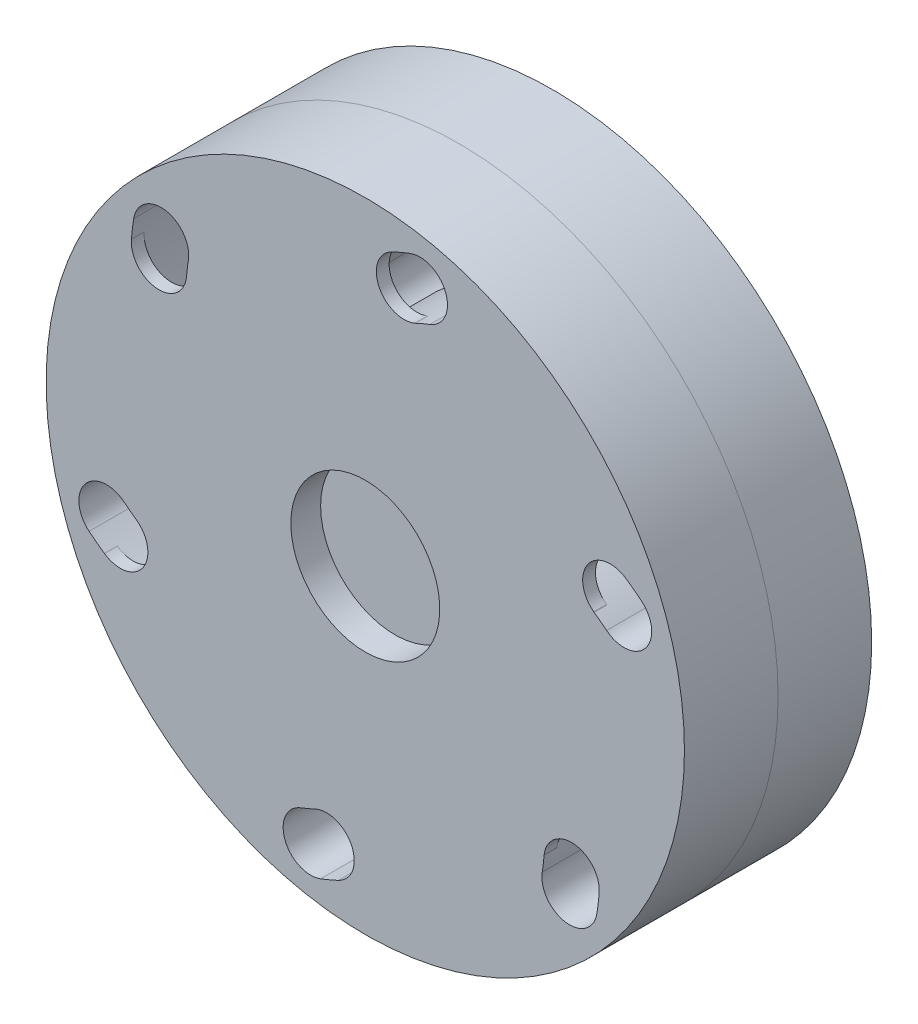
from build123d import *

# Parameters (mm, degrees)
SKETCH1_R                = 75
SKETCH1_R_2              = 70
BOSS_EXTRUDE1_DEPTH      = 22
CUT_EXTRUDE2_DEPTH       = 19
CUT_EXTRUDE3_DEPTH       = 10
CUT_EXTRUDE7_DEPTH       = 8
CUT_EXTRUDE6_START       = 109.323589305
CUT_EXTRUDE6_DEPTH       = 113.823589305
CUT_EXTRUDE8_DEPTH       = 9.25
SKETCH11_R               = 3
CUT_EXTRUDE9_DEPTH       = 9.25
CUT_EXTRUDE10_START      = -3
CUT_EXTRUDE10_DEPTH      = 3
CIRPATTERN2_COUNT        = 6
SKETCH18_R               = 5
CUT_EXTRUDE13_DEPTH      = 5
CUT_EXTRUDE14_DEPTH      = 115.830309588
CUT_EXTRUDE14_DEPTH_BACK = 7
SKETCH20_R               = 17.5


# Read off the part's stored shape, not the designer's step: Cut-Extrude10
with BuildPart() as part:
    # Sketch1 → Boss-Extrude1 (new body)
    # profile 1 of 2: a face of its own
    with BuildSketch(Plane.XY):
        Circle(SKETCH1_R)
        Circle(SKETCH1_R_2, mode=Mode.SUBTRACT)
    # profile 2 of 2: a face of its own
    with BuildSketch(Plane.XY):
        Circle(SKETCH1_R_2)
    extrude(amount=BOSS_EXTRUDE1_DEPTH)

    # Sketch4 → Cut-Extrude2 (cut)
    with BuildSketch(Plane.XY.offset(22)):
        with BuildLine():
            ThreePointArc((54.419786726, -43.518007072), (53.216834216, -18.476231144), (42.119786726, 4.004720201))
            ThreePointArc((42.119786726, 4.004720201), (32.995279799, 5.119786726), (31.880213274, -4.004720201))
            ThreePointArc((31.880213274, -4.004720201), (40.631543409, -21.733600529), (41.580213274, -41.481992928))
            ThreePointArc((41.580213274, -41.481992928), (46.981992928, -48.919786726), (54.419786726, -43.518007072))
        make_face()
    cut_extrude2 = extrude(amount=-CUT_EXTRUDE2_DEPTH, mode=Mode.SUBTRACT)

    # Sketch4<3> → Cut-Extrude3 (cut)
    with BuildSketch(Plane.XY.offset(22)):
        with BuildLine():
            ThreePointArc((39.995234493, -40.237763011), (33.113375849, -8.776911902), (7.518049478, 10.768532552))
            ThreePointArc((7.518049478, 10.768532552), (5.328436439, 9.615018469), (6.481950522, 7.42540543))
            ThreePointArc((6.481950522, 7.42540543), (30.16104925, -10.656743717), (36.52768853, -39.762236989))
            ThreePointArc((36.52768853, -39.762236989), (38.023698501, -41.733772981), (39.995234493, -40.237763011))
        make_face()
    cut_extrude3 = extrude(amount=-CUT_EXTRUDE3_DEPTH, mode=Mode.SUBTRACT)

    # Sketch7 → Cut-Extrude7 (cut)
    with BuildSketch(Plane.XY.offset(22)):
        with BuildLine():
            ThreePointArc((31.880213274, -4.004720201), (30.193449169, -1.965487549), (28.397965297, -0.021296041))
            ThreePointArc((28.397965297, -0.021296041), (28.5124774, 9.170378412), (37.704151864, 9.05586715))
            ThreePointArc((37.704151864, 9.05586715), (39.980899892, 6.590551742), (42.119786726, 4.004720201))
            ThreePointArc((42.119786726, 4.004720201), (32.995279799, 5.119786726), (31.880213274, -4.004720201))
        make_face()
    cut_extrude7 = extrude(amount=-CUT_EXTRUDE7_DEPTH, mode=Mode.SUBTRACT)

    # Sketch6 → Cut-Extrude6 (cut)
    with BuildSketch(Plane.XY.offset(22).offset(CUT_EXTRUDE6_START)):
        with BuildLine():
            ThreePointArc((41.580213274, -41.481992928), (42.740685569, -46.319635023), (46.981992928, -48.919786726))
            Line((46.981992928, -48.919786726), (37.945539013, -48.919786726))
            ThreePointArc((37.945539013, -48.919786726), (35.329112337, -12.653855306), (7.518049478, 10.768532552))
            Line((7.518049478, 10.768532552), (28.5124774, 9.170378412))
            ThreePointArc((28.5124774, 9.170378412), (26.551563362, 4.598257417), (28.397965297, -0.021296041))
            ThreePointArc((28.397965297, -0.021296041), (39.898780935, -19.190629411), (41.580213274, -41.481992928))
        make_face()
    cut_extrude6 = extrude(amount=-CUT_EXTRUDE6_DEPTH, mode=Mode.SUBTRACT)

    # Sketch9 → Cut-Extrude8 (cut)
    with BuildSketch(Plane.XY.offset(22)):
        with BuildLine():
            ThreePointArc((36.460255403, -40.234588948), (30.675277082, -11.484803097), (7.880639715, 6.965689252))
            ThreePointArc((7.880639715, 6.965689252), (6.607721905, 6.349507258), (7.223903899, 5.076589449))
            ThreePointArc((7.223903899, 5.076589449), (28.96445399, -12.520700943), (34.481918862, -39.941016928))
            ThreePointArc((34.481918862, -39.941016928), (35.324301122, -41.076971208), (36.460255403, -40.234588948))
        make_face()
    cut_extrude8 = extrude(amount=-CUT_EXTRUDE8_DEPTH, mode=Mode.SUBTRACT)

    # Sketch11 → Cut-Extrude9 (cut)
    with BuildSketch(Plane.XY.offset(22)):
        with BuildLine():
            Line((34.782544278, -30.416401894), (20.063474663, -45.986137745))
            ThreePointArc((20.063474663, -45.986137745), (23.0980049, -59.723306078), (34.740250052, -51.825439568))
            Line((34.740250052, -51.825439568), (36.460255403, -40.234588948))
            ThreePointArc((36.460255403, -40.234588948), (35.324301122, -41.076971208), (34.481918862, -39.941016928))
            ThreePointArc((34.481918862, -39.941016928), (34.908195949, -35.187419674), (34.782544278, -30.416401894))
        make_face()
        with Locations((26.240250052, -51.825439568)):
            Circle(SKETCH11_R, mode=Mode.SUBTRACT)
    cut_extrude9 = extrude(amount=-CUT_EXTRUDE9_DEPTH, mode=Mode.SUBTRACT)

    # Cut-Extrude10 outline → Cut-Extrude10 (cut)
    with BuildSketch(Plane.XY.offset(3).offset(CUT_EXTRUDE10_START)):
        with BuildLine():
            ThreePointArc((42.017309015, -37.839770406), (41.833208955, -39.665015679), (41.580213274, -41.481992928))
            ThreePointArc((41.580213274, -41.481992928), (46.981992928, -48.919786726), (54.419786726, -43.518007072))
            ThreePointArc((54.419786726, -43.518007072), (54.731838722, -41.286609896), (54.961945654, -39.045279799))
            ThreePointArc((54.961945654, -39.045279799), (49.148693035, -32.033987126), (42.032089748, -37.717831654))
            Line((42.032089748, -37.717831654), (42.017309015, -37.839770406))
        make_face()
    cut_extrude10 = extrude(amount=CUT_EXTRUDE10_DEPTH, mode=Mode.SUBTRACT)

    # CirPattern2: Cut-Extrude2, Cut-Extrude3, Cut-Extrude7, Cut-Extrude6, Cut-Extrude8, Cut-Extrude9, Cut-Extrude10 ×6 about axis
    cirpattern2_axis = Axis((0, 0, 0), (0, 0, 1))
    add([cut_extrude2.rotate(cirpattern2_axis, i * 360 / CIRPATTERN2_COUNT) for i in range(1, CIRPATTERN2_COUNT)], mode=Mode.SUBTRACT)
    add([cut_extrude3.rotate(cirpattern2_axis, i * 360 / CIRPATTERN2_COUNT) for i in range(1, CIRPATTERN2_COUNT)], mode=Mode.SUBTRACT)
    add([cut_extrude7.rotate(cirpattern2_axis, i * 360 / CIRPATTERN2_COUNT) for i in range(1, CIRPATTERN2_COUNT)], mode=Mode.SUBTRACT)
    add([cut_extrude6.rotate(cirpattern2_axis, i * 360 / CIRPATTERN2_COUNT) for i in range(1, CIRPATTERN2_COUNT)], mode=Mode.SUBTRACT)
    add([cut_extrude8.rotate(cirpattern2_axis, i * 360 / CIRPATTERN2_COUNT) for i in range(1, CIRPATTERN2_COUNT)], mode=Mode.SUBTRACT)
    add([cut_extrude9.rotate(cirpattern2_axis, i * 360 / CIRPATTERN2_COUNT) for i in range(1, CIRPATTERN2_COUNT)], mode=Mode.SUBTRACT)
    add([cut_extrude10.rotate(cirpattern2_axis, i * 360 / CIRPATTERN2_COUNT) for i in range(1, CIRPATTERN2_COUNT)], mode=Mode.SUBTRACT)


with BuildPart() as body_2:
    # Mirror1: mirrored copy
    add(part.part.mirror(Plane.XY.offset(22)))

    # Sketch20 → Cut-Extrude14 (cut, two sides: drawn at the far end of the back side and taken through both)
    with BuildSketch(Plane.XY.offset(44).offset(-CUT_EXTRUDE14_DEPTH_BACK)):
        with Locations(Location((0, 0, 0), (0, 0, 180))):
            Circle(SKETCH20_R)
    extrude(amount=CUT_EXTRUDE14_DEPTH + CUT_EXTRUDE14_DEPTH_BACK, mode=Mode.SUBTRACT)


with BuildPart() as part_1:
    add(part.part)

    # Sketch18 → Cut-Extrude13 (cut)
    with BuildSketch(Plane(origin=(0, 0, 0), x_dir=(-1, 0, 0), z_dir=(0, 0, -1))):
        with Locations((0, 17.5)):
            Circle(SKETCH18_R)
        with Locations((17.5, 0)):
            Circle(SKETCH18_R)
        with Locations((0, -17.5)):
            Circle(SKETCH18_R)
        with Locations((-17.5, 0)):
            Circle(SKETCH18_R)
    extrude(amount=-CUT_EXTRUDE13_DEPTH, mode=Mode.SUBTRACT)


solid = Compound([body_2.part, part_1.part])
